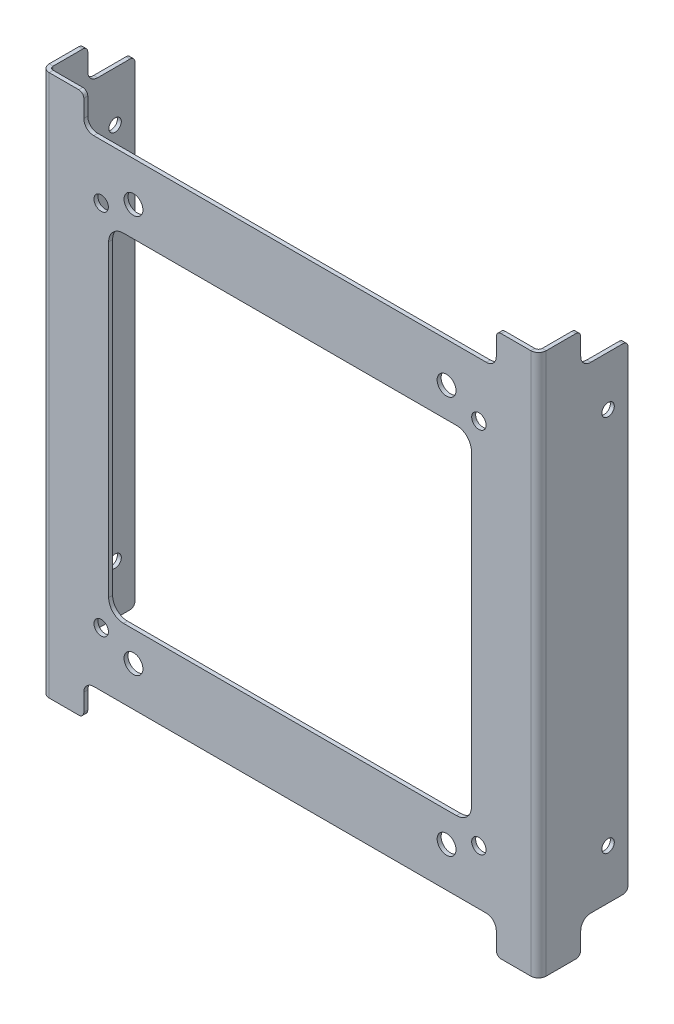
from build123d import *

# Parameters (mm, degrees)
BASE_FLANGE1_DEPTH               = 0.8
EDGE_FLANGE1_STRIP_W             = 4.6732
EDGE_FLANGE1_STRIP_H             = 0.8
EDGE_FLANGE1_STRIP_CUT_DEPTH     = 109
EDGE_FLANGE1_DEPTH               = 109
EDGE_FLANGE2_STRIP_W             = 4.6732
EDGE_FLANGE2_STRIP_H             = 0.8
EDGE_FLANGE2_STRIP_CUT_DEPTH     = 109
EDGE_FLANGE2_DEPTH               = 109
MAIN_START                       = 49.2
MAIN_U_CONNECTORS_OUTLINE_R      = 1.25
MAIN_U_CONNECTORS_DEPTH          = 0.8
SOLAR_START                      = 49.2
SOLAR_PANEL_CONNECTORS_OUTLINE_R = 1.9
SOLAR_PANEL_CONNECTORS_DEPTH     = 0.8
CUT_EXTRUDE2_DEPTH               = 0.8
CUT_EXTRUDE3_DEPTH               = 10
SKETCH21_R                       = 1.45
CUT_EXTRUDE4_DEPTH               = 10
FILLET1_R                        = 1


# Read off the part's stored shape, not the designer's step: Main U Connectors, Solar Panel Connectors 
# Sheet-metal steps are written as plain solids
with BuildPart() as part:
    # Sketch1 → Base-Flange1 (new body)
    with BuildSketch(Plane.XY.offset(50)):
        with BuildLine():
            Line((-39.5, 48), (39.5, 48))
            ThreePointArc((39.5, 48), (40.914213562, 48.585786438), (41.5, 50))
            Line((41.5, 50), (41.5, 54.5))
            Line((41.5, 54.5), (50, 54.5))
            Line((50, 54.5), (50, 48))
            Line((50, 48), (50, -48))
            Line((50, -48), (50, -54.5))
            Line((50, -54.5), (41.5, -54.5))
            Line((41.5, -54.5), (41.5, -50))
            ThreePointArc((41.5, -50), (40.914213562, -48.585786438), (39.5, -48))
            Line((39.5, -48), (-39.5, -48))
            ThreePointArc((-39.5, -48), (-40.914213562, -48.585786438), (-41.5, -50))
            Line((-41.5, -50), (-41.5, -54.5))
            Line((-41.5, -54.5), (-50, -54.5))
            Line((-50, -54.5), (-50, -48))
            Line((-50, -48), (-50, 48))
            Line((-50, 48), (-50, 54.5))
            Line((-50, 54.5), (-41.5, 54.5))
            Line((-41.5, 54.5), (-41.5, 50))
            ThreePointArc((-41.5, 50), (-40.914213562, 48.585786438), (-39.5, 48))
        make_face()
    extrude(amount=-BASE_FLANGE1_DEPTH)

    # Edge-Flange1 strip (across the edge) → Edge-Flange1 strip cut (cut)
    with BuildSketch(Plane(origin=(50, 54.5, 49.2), x_dir=(-1, 0, 0), z_dir=(0, -1, 0))):
        with Locations((-0.8, -0.4)):
            Rectangle(EDGE_FLANGE1_STRIP_W, EDGE_FLANGE1_STRIP_H)
    extrude(amount=EDGE_FLANGE1_STRIP_CUT_DEPTH, mode=Mode.SUBTRACT)

    # Edge-Flange1 section (across the edge) → Edge-Flange1 (add)
    with BuildSketch(Plane(origin=(50, 54.5, 49.2), x_dir=(-1, 0, 0), z_dir=(0, -1, 0))):
        with BuildLine():
            Line((0, 0.7366), (0, 17.2))
            Line((0, 17.2), (0.8, 17.2))
            Line((0.8, 17.2), (0.8, 0.7366))
            ThreePointArc((0.8, 0.7366), (1.015745145, 0.215745145), (1.5366, 0))
            Line((1.5366, 0), (1.5366, -0.8))
            ThreePointArc((1.5366, -0.8), (0.45005972, -0.34994028), (0, 0.7366))
        make_face()
    extrude(amount=EDGE_FLANGE1_DEPTH)

    # Edge-Flange2 strip (across the edge) → Edge-Flange2 strip cut (cut)
    with BuildSketch(Plane(origin=(-50, -54.5, 49.2), x_dir=(1, 0, 0), z_dir=(0, 1, 0))):
        with Locations((-0.8, -0.4)):
            Rectangle(EDGE_FLANGE2_STRIP_W, EDGE_FLANGE2_STRIP_H)
    extrude(amount=EDGE_FLANGE2_STRIP_CUT_DEPTH, mode=Mode.SUBTRACT)

    # Edge-Flange2 section (across the edge) → Edge-Flange2 (add)
    with BuildSketch(Plane(origin=(-50, -54.5, 49.2), x_dir=(1, 0, 0), z_dir=(0, 1, 0))):
        with BuildLine():
            Line((0, 0.7366), (0, 17.2))
            Line((0, 17.2), (0.8, 17.2))
            Line((0.8, 17.2), (0.8, 0.7366))
            ThreePointArc((0.8, 0.7366), (1.015745145, 0.215745145), (1.5366, 0))
            Line((1.5366, 0), (1.5366, -0.8))
            ThreePointArc((1.5366, -0.8), (0.45005972, -0.34994028), (0, 0.7366))
        make_face()
    extrude(amount=EDGE_FLANGE2_DEPTH)

    # Main U Connectors outline → Main U Connectors (cut)
    with BuildSketch(Plane.YZ.offset(MAIN_START)):
        with Locations((-38, 36)):
            Circle(MAIN_U_CONNECTORS_OUTLINE_R)
        with Locations((38, 36)):
            Circle(MAIN_U_CONNECTORS_OUTLINE_R)
    main_u_connectors = extrude(amount=MAIN_U_CONNECTORS_DEPTH, mode=Mode.SUBTRACT)

    # Solar Panel Connectors outline → Solar Panel Connectors (cut)
    with BuildSketch(Plane.XY.offset(SOLAR_START)):
        with Locations((-31.5, 40)):
            Circle(SOLAR_PANEL_CONNECTORS_OUTLINE_R)
        with Locations((31.5, 40)):
            Circle(SOLAR_PANEL_CONNECTORS_OUTLINE_R)
        with Locations((31.5, -40)):
            Circle(SOLAR_PANEL_CONNECTORS_OUTLINE_R)
        with Locations((-31.5, -40)):
            Circle(SOLAR_PANEL_CONNECTORS_OUTLINE_R)
    extrude(amount=SOLAR_PANEL_CONNECTORS_DEPTH, mode=Mode.SUBTRACT)

    # Sketch18 → Cut-Extrude2 (cut)
    with BuildSketch(Plane.XY.offset(50)):
        with BuildLine():
            Line((-33.5, -34), (33.5, -34))
            ThreePointArc((33.5, -34), (35.621320344, -33.121320344), (36.5, -31))
            Line((36.5, -31), (36.5, 31))
            ThreePointArc((36.5, 31), (35.621320344, 33.121320344), (33.5, 34))
            Line((33.5, 34), (-33.5, 34))
            ThreePointArc((-33.5, 34), (-35.621320344, 33.121320344), (-36.5, 31))
            Line((-36.5, 31), (-36.5, -31))
            ThreePointArc((-36.5, -31), (-35.621320344, -33.121320344), (-33.5, -34))
        make_face()
    extrude(amount=-CUT_EXTRUDE2_DEPTH, mode=Mode.SUBTRACT)

    # Sketch19 → Cut-Extrude3 (cut)
    with BuildSketch(Plane(origin=(50, 0, 0), x_dir=(0, 0, -1), z_dir=(1, 0, 0))):
        with BuildLine():
            Line((-32, 54.5), (-41.5, 54.5))
            Line((-41.5, 54.5), (-41.5, 50))
            ThreePointArc((-41.5, 50), (-40.914213562, 48.585786438), (-39.5, 48))
            Line((-39.5, 48), (-32, 48))
            Line((-32, 48), (-32, 54.5))
        make_face()
        with BuildLine():
            Line((-41.5, -54.5), (-41.5, -50))
            ThreePointArc((-41.5, -50), (-40.914213562, -48.585786438), (-39.5, -48))
            Line((-39.5, -48), (-32, -48))
            Line((-32, -48), (-32, -54.5))
            Line((-32, -54.5), (-41.5, -54.5))
        make_face()
    cut_extrude3 = extrude(amount=-CUT_EXTRUDE3_DEPTH, mode=Mode.SUBTRACT)

    # Mirror1: Main U Connectors, Cut-Extrude3 across plane
    add(main_u_connectors.mirror(Plane(origin=(0, 0, 0), x_dir=(0, 0, 1), z_dir=(1, 0, 0))), mode=Mode.SUBTRACT)
    add(cut_extrude3.mirror(Plane(origin=(0, 0, 0), x_dir=(0, 0, 1), z_dir=(1, 0, 0))), mode=Mode.SUBTRACT)

    # Sketch21 → Cut-Extrude4 (cut)
    with BuildSketch(Plane.XY.offset(50)):
        with Locations((-38, 37)):
            Circle(SKETCH21_R)
        with Locations((38, 37)):
            Circle(SKETCH21_R)
        with Locations((38, -37)):
            Circle(SKETCH21_R)
        with Locations((-38, -37)):
            Circle(SKETCH21_R)
    extrude(amount=-CUT_EXTRUDE4_DEPTH, mode=Mode.SUBTRACT)

    # Fillet1
    fillet1_edges = [part.edges().sort_by_distance(p)[0] for p in [
        (49.6, 48, 32),
        (49.6, 54.5, 41.5),
        (49.6, -48, 32),
        (49.6, -54.5, 41.5),
        (-49.6, 48, 32),
        (-49.6, 54.5, 41.5),
        (-49.6, -54.5, 41.5),
        (-49.6, -48, 32),
        (-41.5, 54.5, 49.6),
        (41.5, 54.5, 49.6),
        (41.5, -54.5, 49.6),
        (-41.5, -54.5, 49.6),
    ]]
    fillet(fillet1_edges, radius=FILLET1_R)


solid = part.part
